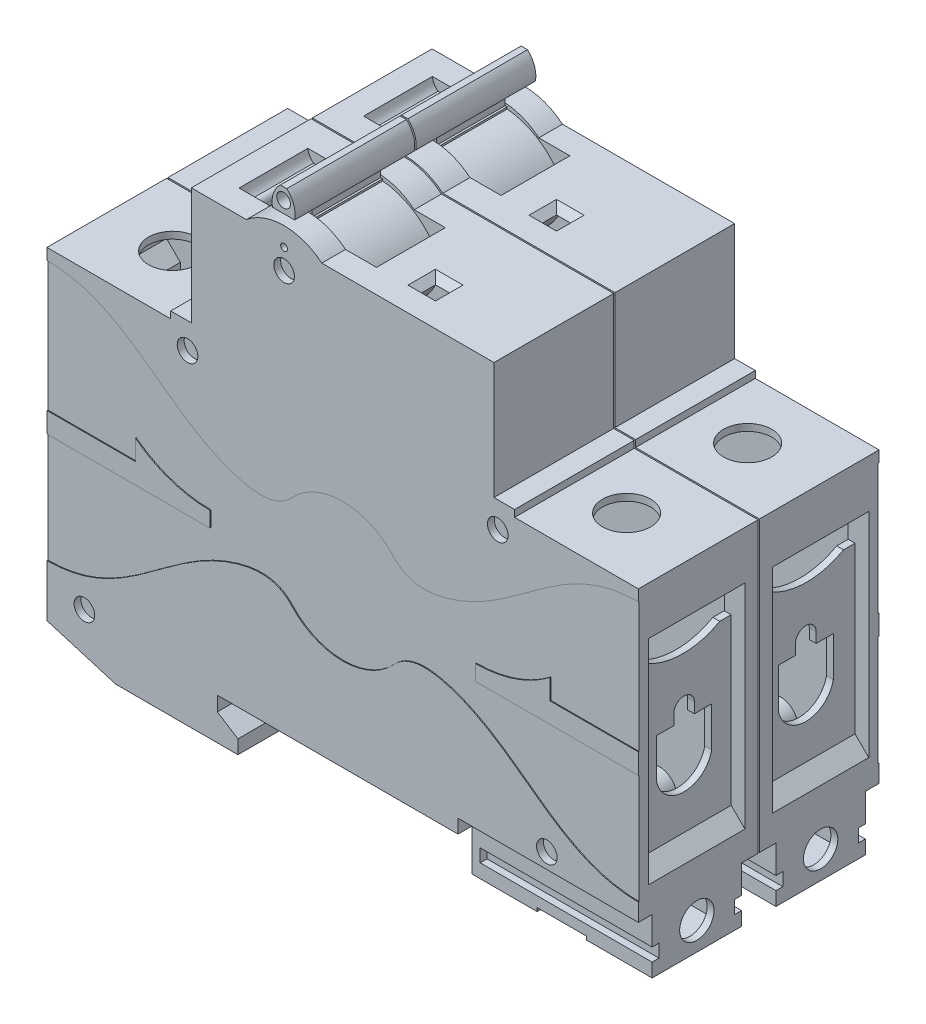
from build123d import *

# Parameters (mm, degrees)
BOSS_EXTRUDE1_DEPTH           = 17.5
SKETCH2_W                     = 26.226226643
SKETCH2_H                     = 2
SKETCH2_H_2                   = 5
CUT_EXTRUDE1_DEPTH            = 8
SKETCH3_W                     = 3
SKETCH3_H                     = 1.896489695
SKETCH3_W_2                   = 7
CUT_EXTRUDE2_DEPTH            = 25
SKETCH4_W                     = 7.201775376
SKETCH4_H                     = 1
CUT_EXTRUDE3_DEPTH            = 0.5
SKETCH6_W                     = 14
SKETCH6_H                     = 31
CUT_EXTRUDE5_DEPTH            = 2
CHAMFER1_SIZE                 = 2
SKETCH21_R                    = 2.5
SKETCH21_R_2                  = 1.5
BOSS_EXTRUDE3_DEPTH           = 35
SKETCH22_R                    = 1.5
CUT_EXTRUDE19_DEPTH           = 66.566759871
SKETCH14_W                    = 86
SKETCH14_H                    = 0.2
CUT_EXTRUDE11_DEPTH           = 83.33620103
CUT_EXTRUDE12_DEPTH           = 5
CUT_EXTRUDE12_DEPTH_BACK      = 3
SKETCH15_W                    = 20
SKETCH15_H                    = 10
CHAMFER1_OF_MIRROR1_SIZE      = 2
SHELL2_START                  = -16.5
SHELL2_OUTLINE_R              = 2.5
SHELL2_DEPTH                  = 15.4
SHELL2_START_2                = 1.1
SHELL2_2_OUTLINE_R            = 2.5
SHELL2_2_DEPTH                = 15.4
SHELL2_START_3                = -13.5
SHELL2_3_DEPTH                = 9
SHELL2_START_4                = 4.5
SHELL2_4_DEPTH                = 9
SHELL2_START_5                = -14.5
SHELL2_5_DEPTH                = 11
SHELL2_START_6                = 3.5
SHELL2_6_DEPTH                = 11
SHELL2_START_7                = -3.052474892
SHELL2_7_DEPTH                = 1.952474892
SHELL2_8_DEPTH                = 1.952474892
SHELL2_9_DEPTH                = 1.447525108
SHELL2_START_8                = 15.052474892
SHELL2_10_DEPTH               = 1.447525108
SKETCH13_W                    = 4
SKETCH13_H                    = 4
CUT_EXTRUDE10_DEPTH           = 2
CUT_EXTRUDE10_DRAFT           = -44
CUT_EXTRUDE10_PROFILE_2_DEPTH = 2
CUT_EXTRUDE10_PROFILE_2_DRAFT = -44
SKETCH9_R                     = 2.5
CUT_EXTRUDE8_DEPTH            = 10
SKETCH5_W                     = 1
SKETCH5_H                     = 8
CUT_EXTRUDE4_DEPTH            = 2
CUT_EXTRUDE7_DEPTH            = 10
CUT_EXTRUDE9_DEPTH            = 10
SKETCH16_R                    = 0.5
CUT_EXTRUDE17_DEPTH           = 66.566759871
SKETCH18_R                    = 3.5
CUT_EXTRUDE15_DEPTH           = 5
SKETCH23_R                    = 1.5
BOSS_EXTRUDE4_DEPTH           = 10
BOSS_EXTRUDE10_DEPTH          = 10
BOSS_EXTRUDE12_DEPTH          = 10
BOSS_EXTRUDE13_DEPTH          = 10
SKETCH31_R                    = 1.5
CUT_EXTRUDE20_DEPTH           = 67.356066779
BOSS_EXTRUDE14_DEPTH          = 10
SKETCH29_R                    = 1
BOSS_EXTRUDE15_DEPTH          = 35
SKETCH20_W                    = 86
SKETCH20_H                    = 0.2
CUT_EXTRUDE16_DEPTH           = 16
SKETCH32_R                    = 1.5
BOSS_EXTRUDE20_DEPTH          = 33
BOSS_EXTRUDE20_2_DEPTH        = 33
BOSS_EXTRUDE20_3_DEPTH        = 33
BOSS_EXTRUDE20_4_DEPTH        = 33
BOSS_EXTRUDE20_5_DEPTH        = 33
CUT_EXTRUDE21_DEPTH           = 0.125
CUT_EXTRUDE22_DEPTH           = 0.125


# Read off the part's stored shape, not the designer's step: Shell2
with BuildPart() as part:
    # Sketch1 → Boss-Extrude1 (new, symmetric)
    with BuildSketch(Plane.XY):
        with BuildLine():
            Line((-43, 15), (-25, 15))
            Line((-25, 15), (-25, 16))
            Line((-25, 16), (-22, 16))
            Line((-22, 16), (-22, 33))
            Line((-22, 33), (-14, 33))
            ThreePointArc((-14, 33), (-8.517768827, 34.98565789), (-3.035537653, 33))
            Line((-3.035537653, 33), (22, 33))
            Line((22, 33), (22, 16))
            Line((22, 16), (25, 16))
            Line((25, 16), (25, 15))
            Line((25, 15), (43, 15))
            Line((43, 15), (43, -35))
            Line((43, -35), (16.773773357, -35))
            Line((16.773773357, -35), (16.773773357, -29))
            Line((16.773773357, -29), (-18.226226643, -29))
            Line((-18.226226643, -29), (-18.226226643, -31.103510305))
            Line((-18.226226643, -31.103510305), (-15.226226643, -33))
            Line((-15.226226643, -33), (-15.226226643, -35))
            Line((-15.226226643, -35), (-33, -35))
            Line((-33, -35), (-43, -32))
            Line((-43, -32), (-43, 15))
        make_face()
    extrude(amount=BOSS_EXTRUDE1_DEPTH, both=True)

    # Sketch2 → Cut-Extrude1 (cut)
    with BuildSketch(Plane.XZ.offset(35)):
        with Locations((29.886886678, 16.5)):
            Rectangle(SKETCH2_W, SKETCH2_H)
        with Locations((29.886886678, 0)):
            Rectangle(SKETCH2_W, SKETCH2_H_2)
        with Locations((29.886886678, -16.5)):
            Rectangle(SKETCH2_W, SKETCH2_H)
    extrude(amount=-CUT_EXTRUDE1_DEPTH, mode=Mode.SUBTRACT)

    # Sketch3 → Cut-Extrude2 (cut)
    with BuildSketch(Plane(origin=(43, 0, 0), x_dir=(0, 0, -1), z_dir=(1, 0, 0))):
        with Locations((16, -32.051755153)):
            Rectangle(SKETCH3_W, SKETCH3_H)
        with Locations((0, -32.051755153)):
            Rectangle(SKETCH3_W_2, SKETCH3_H)
        with Locations((-16, -32.051755153)):
            Rectangle(SKETCH3_W, SKETCH3_H)
    extrude(amount=-CUT_EXTRUDE2_DEPTH, mode=Mode.SUBTRACT)

    # Sketch4 → Cut-Extrude3 (cut)
    with BuildSketch(Plane.XZ.offset(35)):
        with Locations((29.886886679, 15.5)):
            Rectangle(SKETCH4_W, SKETCH4_H)
        with Locations((29.886886679, 2.5)):
            Rectangle(SKETCH4_W, SKETCH4_H)
        with Locations((29.886886679, -2.5)):
            Rectangle(SKETCH4_W, SKETCH4_H)
        with Locations((29.886886679, -15.5)):
            Rectangle(SKETCH4_W, SKETCH4_H)
    extrude(amount=-CUT_EXTRUDE3_DEPTH, mode=Mode.SUBTRACT)

    # Sketch6 → Cut-Extrude5 (cut)
    with BuildSketch(Plane.ZY.offset(43)):
        with Locations((-9, -7.5)):
            Rectangle(SKETCH6_W, SKETCH6_H)
        with Locations((9, -7.5)):
            Rectangle(SKETCH6_W, SKETCH6_H)
    cut_extrude5 = extrude(amount=-CUT_EXTRUDE5_DEPTH, mode=Mode.SUBTRACT)

    # Chamfer1
    chamfer1_edges = [part.edges().sort_by_distance(p)[0] for p in [
        (-41, -23, 9),
        (-41, -23, -9),
        (-41, 8, 9),
        (-41, 8, -9),
    ]]
    chamfer(chamfer1_edges, length=CHAMFER1_SIZE - 0.0001)  # a hair under: the kernel refuses the full size

    # Sketch21 → Boss-Extrude3 (add)
    # profile 1 of 4: a face of its own
    with BuildSketch(Plane.XY.offset(17.5)):
        with Locations((-22.553517734, 12.23222424)):
            Circle(SKETCH21_R)
        with Locations((-22.553517734, 12.23222424)):
            Circle(SKETCH21_R_2, mode=Mode.SUBTRACT)
    # profile 2 of 4: a face of its own
    with BuildSketch(Plane.XY.offset(17.5)):
        with Locations((-37.547263916, -27.874280993)):
            Circle(SKETCH21_R)
        with Locations((-37.547263916, -27.874280993)):
            Circle(SKETCH21_R_2, mode=Mode.SUBTRACT)
    # profile 3 of 4: a face of its own
    with BuildSketch(Plane.XY.offset(17.5)):
        with BuildLine():
            ThreePointArc((30.819031875, -27), (31.82295748, -26.078429992), (32.19438906, -24.767248662))
            ThreePointArc((32.19438906, -24.767248662), (28.38320773, -22.638680242), (28.569746246, -27))
            Line((28.569746246, -27), (30.819031875, -27))
        make_face()
        with Locations((29.69438906, -24.767248662)):
            Circle(SKETCH21_R_2, mode=Mode.SUBTRACT)
    # profile 4 of 4: a face of its own
    with BuildSketch(Plane.XY.offset(17.5)):
        with Locations((22.553517734, 12.23222424)):
            Circle(SKETCH21_R)
    extrude(amount=-BOSS_EXTRUDE3_DEPTH)

    # Sketch22 → Cut-Extrude19 (cut, through all)
    with BuildSketch(Plane.XY.offset(17.5)):
        with Locations((22.553517734, 12.23222424)):
            Circle(SKETCH22_R)
        with Locations((-22.553517734, 12.23222424)):
            Circle(SKETCH22_R)
        with Locations((-37.547263916, -27.874280993)):
            Circle(SKETCH22_R)
        with Locations((29.69438906, -24.767248662)):
            Circle(SKETCH22_R)
    extrude(amount=-CUT_EXTRUDE19_DEPTH, mode=Mode.SUBTRACT)

    # Sketch14 → Cut-Extrude11 (cut, through all)
    with BuildSketch(Plane(origin=(0, 33, 0), x_dir=(1, 0, 0), z_dir=(0, 1, 0))):
        Rectangle(SKETCH14_W, SKETCH14_H)
    extrude(amount=-CUT_EXTRUDE11_DEPTH, mode=Mode.SUBTRACT)

    # Sketch15 → Cut-Extrude12 (cut, two sides: drawn at the far end of the back side and taken through both)
    with BuildSketch(Plane(origin=(0, 33, 0), x_dir=(1, 0, 0), z_dir=(0, 1, 0)).offset(-CUT_EXTRUDE12_DEPTH_BACK)):
        with Locations((-8.517768827, 9.052474892)):
            Rectangle(SKETCH15_W, SKETCH15_H)
        with Locations((-8.517768827, -9.052474892)):
            Rectangle(SKETCH15_W, SKETCH15_H)
    extrude(amount=CUT_EXTRUDE12_DEPTH + CUT_EXTRUDE12_DEPTH_BACK, mode=Mode.SUBTRACT)

    # Mirror1: Cut-Extrude5 across plane
    add(cut_extrude5.mirror(Plane(origin=(0, 0, 0), x_dir=(0, 0, 1), z_dir=(1, 0, 0))), mode=Mode.SUBTRACT)

    # Chamfer1 of Mirror1
    chamfer1_of_mirror1_edges = [part.edges().sort_by_distance(p)[0] for p in [
        (41, -23, 9),
        (41, -23, -9),
        (41, 8, 9),
        (41, 8, -9),
    ]]
    chamfer(chamfer1_of_mirror1_edges, length=CHAMFER1_OF_MIRROR1_SIZE - 0.0001)  # a hair under: the kernel refuses the full size

    # Shell2 outline → Shell2 (cut)
    with BuildSketch(Plane.XY.offset(SHELL2_START)):
        with BuildLine():
            Line((2.482231173, 30), (-19.517768827, 30))
            Line((-19.517768827, 30), (-19.517768827, 32))
            Line((-19.517768827, 32), (-21, 32))
            Line((-21, 32), (-21, 15))
            Line((-21, 15), (-24, 15))
            Line((-24, 15), (-24, 14.271265449))
            ThreePointArc((-24, 14.271265449), (-20.940684333, 10.322049268), (-24.32127588, 14))
            Line((-24.32127588, 14), (-42, 14))
            Line((-42, 14), (-42, 8.414213562))
            Line((-42, 8.414213562), (-40, 6.414213562))
            Line((-40, 6.414213562), (-40, -21.414213562))
            Line((-40, -21.414213562), (-42, -23.414213562))
            Line((-42, -23.414213562), (-42, -31.255969349))
            Line((-42, -31.255969349), (-32.853231164, -34))
            Line((-32.853231164, -34), (-16.226226643, -34))
            Line((-16.226226643, -34), (-16.226226643, -33.55089651))
            Line((-16.226226643, -33.55089651), (-19.226226643, -31.654406815))
            Line((-19.226226643, -31.654406815), (-19.226226643, -28))
            Line((-19.226226643, -28), (15.773773357, -28))
            Line((15.773773357, -28), (15.773773357, -26))
            Line((15.773773357, -26), (27.519458225, -26))
            ThreePointArc((27.519458225, -26), (29.69438906, -22.267248662), (31.869319895, -26))
            Line((31.869319895, -26), (42, -26))
            Line((42, -26), (42, -23.414213562))
            Line((42, -23.414213562), (40, -21.414213562))
            Line((40, -21.414213562), (40, 6.414213562))
            Line((40, 6.414213562), (42, 8.414213562))
            Line((42, 8.414213562), (42, 14))
            Line((42, 14), (24.32127588, 14))
            ThreePointArc((24.32127588, 14), (20.940684333, 10.322049268), (24, 14.271265449))
            Line((24, 14.271265449), (24, 15))
            Line((24, 15), (21, 15))
            Line((21, 15), (21, 32))
            Line((21, 32), (2.482231173, 32))
            Line((2.482231173, 32), (2.482231173, 30))
        make_face()
        with Locations((-37.547263916, -27.874280993)):
            Circle(SHELL2_OUTLINE_R, mode=Mode.SUBTRACT)
    extrude(amount=SHELL2_DEPTH, mode=Mode.SUBTRACT)

    # Shell2 2 outline → Shell2 2 (cut)
    with BuildSketch(Plane.XY.offset(SHELL2_START_2)):
        with BuildLine():
            Line((2.482231173, 30), (-19.517768827, 30))
            Line((-19.517768827, 30), (-19.517768827, 32))
            Line((-19.517768827, 32), (-21, 32))
            Line((-21, 32), (-21, 15))
            Line((-21, 15), (-24, 15))
            Line((-24, 15), (-24, 14.271265449))
            ThreePointArc((-24, 14.271265449), (-20.940684333, 10.322049268), (-24.32127588, 14))
            Line((-24.32127588, 14), (-42, 14))
            Line((-42, 14), (-42, 8.414213562))
            Line((-42, 8.414213562), (-40, 6.414213562))
            Line((-40, 6.414213562), (-40, -21.414213562))
            Line((-40, -21.414213562), (-42, -23.414213562))
            Line((-42, -23.414213562), (-42, -31.255969349))
            Line((-42, -31.255969349), (-32.853231164, -34))
            Line((-32.853231164, -34), (-16.226226643, -34))
            Line((-16.226226643, -34), (-16.226226643, -33.55089651))
            Line((-16.226226643, -33.55089651), (-19.226226643, -31.654406815))
            Line((-19.226226643, -31.654406815), (-19.226226643, -28))
            Line((-19.226226643, -28), (15.773773357, -28))
            Line((15.773773357, -28), (15.773773357, -26))
            Line((15.773773357, -26), (27.519458225, -26))
            ThreePointArc((27.519458225, -26), (29.69438906, -22.267248662), (31.869319895, -26))
            Line((31.869319895, -26), (42, -26))
            Line((42, -26), (42, -23.414213562))
            Line((42, -23.414213562), (40, -21.414213562))
            Line((40, -21.414213562), (40, 6.414213562))
            Line((40, 6.414213562), (42, 8.414213562))
            Line((42, 8.414213562), (42, 14))
            Line((42, 14), (24.32127588, 14))
            ThreePointArc((24.32127588, 14), (20.940684333, 10.322049268), (24, 14.271265449))
            Line((24, 14.271265449), (24, 15))
            Line((24, 15), (21, 15))
            Line((21, 15), (21, 32))
            Line((21, 32), (2.482231173, 32))
            Line((2.482231173, 32), (2.482231173, 30))
        make_face()
        with Locations((-37.547263916, -27.874280993)):
            Circle(SHELL2_2_OUTLINE_R, mode=Mode.SUBTRACT)
    extrude(amount=SHELL2_2_DEPTH, mode=Mode.SUBTRACT)

    # Shell2 3 outline → Shell2 3 (cut)
    with BuildSketch(Plane.XY.offset(SHELL2_START_3)):
        with BuildLine():
            Line((42, -26), (31.869319895, -26))
            ThreePointArc((31.869319895, -26), (29.69438906, -27.267248662), (27.519458225, -26))
            Line((27.519458225, -26), (15.773773357, -26))
            Line((15.773773357, -26), (15.773773357, -28))
            Line((15.773773357, -28), (17.773773357, -28))
            Line((17.773773357, -28), (17.773773357, -34))
            Line((17.773773357, -34), (42, -34))
            Line((42, -34), (42, -26))
        make_face()
    extrude(amount=SHELL2_3_DEPTH, mode=Mode.SUBTRACT)

    # Shell2 4 outline → Shell2 4 (cut)
    with BuildSketch(Plane.XY.offset(SHELL2_START_4)):
        with BuildLine():
            Line((42, -26), (31.869319895, -26))
            ThreePointArc((31.869319895, -26), (29.69438906, -27.267248662), (27.519458225, -26))
            Line((27.519458225, -26), (15.773773357, -26))
            Line((15.773773357, -26), (15.773773357, -28))
            Line((15.773773357, -28), (17.773773357, -28))
            Line((17.773773357, -28), (17.773773357, -34))
            Line((17.773773357, -34), (42, -34))
            Line((42, -34), (42, -26))
        make_face()
    extrude(amount=SHELL2_4_DEPTH, mode=Mode.SUBTRACT)

    # Shell2 5 outline → Shell2 5 (cut)
    with BuildSketch(Plane.XY.offset(SHELL2_START_5)):
        with BuildLine():
            Line((42, -30.103510305), (42, -26))
            Line((42, -26), (31.869319895, -26))
            ThreePointArc((31.869319895, -26), (29.69438906, -27.267248662), (27.519458225, -26))
            Line((27.519458225, -26), (15.773773357, -26))
            Line((15.773773357, -26), (15.773773357, -28))
            Line((15.773773357, -28), (17.773773357, -28))
            Line((17.773773357, -28), (17.773773357, -30.103510305))
            Line((17.773773357, -30.103510305), (42, -30.103510305))
        make_face()
    extrude(amount=SHELL2_5_DEPTH, mode=Mode.SUBTRACT)

    # Shell2 6 outline → Shell2 6 (cut)
    with BuildSketch(Plane.XY.offset(SHELL2_START_6)):
        with BuildLine():
            Line((42, -30.103510305), (42, -26))
            Line((42, -26), (31.869319895, -26))
            ThreePointArc((31.869319895, -26), (29.69438906, -27.267248662), (27.519458225, -26))
            Line((27.519458225, -26), (15.773773357, -26))
            Line((15.773773357, -26), (15.773773357, -28))
            Line((15.773773357, -28), (17.773773357, -28))
            Line((17.773773357, -28), (17.773773357, -30.103510305))
            Line((17.773773357, -30.103510305), (42, -30.103510305))
        make_face()
    extrude(amount=SHELL2_6_DEPTH, mode=Mode.SUBTRACT)

    # Shell2 7 outline → Shell2 7 (cut)
    with BuildSketch(Plane.XY.offset(SHELL2_START_7)):
        with BuildLine():
            Line((-19.517768827, 32), (-19.517768827, 30))
            Line((-19.517768827, 30), (2.482231173, 30))
            Line((2.482231173, 30), (2.482231173, 32))
            Line((2.482231173, 32), (-3.410563832, 32))
            ThreePointArc((-3.410563832, 32), (-8.517768826, 33.98565789), (-13.624973821, 32))
            Line((-13.624973821, 32), (-19.517768827, 32))
        make_face()
    extrude(amount=SHELL2_7_DEPTH, mode=Mode.SUBTRACT)

    # Shell2 8 outline → Shell2 8 (cut)
    with BuildSketch(Plane.XY.offset(SHELL2_START_2)):
        with BuildLine():
            Line((-19.517768827, 32), (-19.517768827, 30))
            Line((-19.517768827, 30), (2.482231173, 30))
            Line((2.482231173, 30), (2.482231173, 32))
            Line((2.482231173, 32), (-3.410563832, 32))
            ThreePointArc((-3.410563832, 32), (-8.517768826, 33.98565789), (-13.624973821, 32))
            Line((-13.624973821, 32), (-19.517768827, 32))
        make_face()
    extrude(amount=SHELL2_8_DEPTH, mode=Mode.SUBTRACT)

    # Shell2 9 outline → Shell2 9 (cut)
    with BuildSketch(Plane.XY.offset(SHELL2_START)):
        with BuildLine():
            Line((-19.517768827, 32), (-19.517768827, 30))
            Line((-19.517768827, 30), (2.482231173, 30))
            Line((2.482231173, 30), (2.482231173, 32))
            Line((2.482231173, 32), (-3.410563832, 32))
            ThreePointArc((-3.410563832, 32), (-8.517768826, 33.98565789), (-13.624973821, 32))
            Line((-13.624973821, 32), (-19.517768827, 32))
        make_face()
    extrude(amount=SHELL2_9_DEPTH, mode=Mode.SUBTRACT)

    # Shell2 10 outline → Shell2 10 (cut)
    with BuildSketch(Plane.XY.offset(SHELL2_START_8)):
        with BuildLine():
            Line((-19.517768827, 32), (-19.517768827, 30))
            Line((-19.517768827, 30), (2.482231173, 30))
            Line((2.482231173, 30), (2.482231173, 32))
            Line((2.482231173, 32), (-3.410563832, 32))
            ThreePointArc((-3.410563832, 32), (-8.517768826, 33.98565789), (-13.624973821, 32))
            Line((-13.624973821, 32), (-19.517768827, 32))
        make_face()
    extrude(amount=SHELL2_10_DEPTH, mode=Mode.SUBTRACT)


with BuildPart() as cut_extrude10_tool:
    # Sketch13 → Cut-Extrude10 (with draft: the straight prism first)
    with BuildSketch(Plane(origin=(0, 33, 0), x_dir=(1, 0, 0), z_dir=(0, 1, 0))):
        with Locations((8, 5.6)):
            Rectangle(SKETCH13_W, SKETCH13_H)
    extrude(amount=-CUT_EXTRUDE10_DEPTH)
    # Cut-Extrude10: the draft: its side faces are tilted about the plane it starts from
    cut_extrude10_sides = [cut_extrude10_tool.faces().sort_by_distance(p)[0] for p in [
        (10, 32, -5.6),
        (8, 32, -7.6),
        (6, 32, -5.6),
        (8, 32, -3.6),
    ]]
    draft(cut_extrude10_sides, Plane(origin=(0, 33, 0), x_dir=(1, 0, 0), z_dir=(0, 1, 0)), CUT_EXTRUDE10_DRAFT)


with BuildPart() as part_1:
    add(part.part)

    # Cut-Extrude10: cut by cut_extrude10_tool
    add(cut_extrude10_tool.part, mode=Mode.SUBTRACT)


with BuildPart() as cut_extrude10_profile_2_tool:
    # Sketch13 → Cut-Extrude10 profile 2 (with draft: the straight prism first)
    with BuildSketch(Plane(origin=(0, 33, 0), x_dir=(1, 0, 0), z_dir=(0, 1, 0))):
        with Locations((8, -12)):
            Rectangle(SKETCH13_W, SKETCH13_H)
    extrude(amount=-CUT_EXTRUDE10_PROFILE_2_DEPTH)
    # Cut-Extrude10 profile 2: the draft: its side faces are tilted about the plane it starts from
    cut_extrude10_profile_2_sides = [cut_extrude10_profile_2_tool.faces().sort_by_distance(p)[0] for p in [
        (8, 32, 10),
        (6, 32, 12),
        (8, 32, 14),
        (10, 32, 12),
    ]]
    draft(cut_extrude10_profile_2_sides, Plane(origin=(0, 33, 0), x_dir=(1, 0, 0), z_dir=(0, 1, 0)), CUT_EXTRUDE10_PROFILE_2_DRAFT)


with BuildPart() as part_2:
    add(part_1.part)

    # Cut-Extrude10 profile 2: cut by cut_extrude10_profile_2_tool
    add(cut_extrude10_profile_2_tool.part, mode=Mode.SUBTRACT)

    # Sketch9 → Cut-Extrude8 (cut)
    with BuildSketch(Plane(origin=(43, 0, 0), x_dir=(0, 0, -1), z_dir=(1, 0, 0))):
        with Locations((-9, -31)):
            Circle(SKETCH9_R)
        with Locations((9, -31)):
            Circle(SKETCH9_R)
    extrude(amount=-CUT_EXTRUDE8_DEPTH, mode=Mode.SUBTRACT)

    # Sketch5 → Cut-Extrude4 (cut)
    with BuildSketch(Plane(origin=(-12.357798165, -41.19266055, 0), x_dir=(0.9578262852211513, -0.2873478855663458, 0), z_dir=(-0.2873478855663458, -0.9578262852211514, 0))):
        with Locations((-26.996748548, 8.75)):
            Rectangle(SKETCH5_W, SKETCH5_H)
        with Locations((-29.996748548, 8.75)):
            Rectangle(SKETCH5_W, SKETCH5_H)
        with Locations((-23.996748548, 8.75)):
            Rectangle(SKETCH5_W, SKETCH5_H)
        with Locations((-23.996748548, -8.75)):
            Rectangle(SKETCH5_W, SKETCH5_H)
        with Locations((-26.996748548, -8.75)):
            Rectangle(SKETCH5_W, SKETCH5_H)
        with Locations((-29.996748548, -8.75)):
            Rectangle(SKETCH5_W, SKETCH5_H)
    extrude(amount=-CUT_EXTRUDE4_DEPTH, mode=Mode.SUBTRACT)

    # Sketch8 → Cut-Extrude7 (cut)
    with BuildSketch(Plane.ZY.offset(41)):
        with BuildLine():
            Line((-6.033598852, -0.5), (-5, -0.5))
            Line((-5, -0.5), (-5, 1))
            Line((-5, 1), (-13, 1))
            Line((-13, 1), (-13, -0.5))
            Line((-13, -0.5), (-12.218858052, -0.5))
            Line((-12.218858052, -0.5), (-12.218858052, -1.5))
            Line((-12.218858052, -1.5), (-13, -1.5))
            Line((-13, -1.5), (-13, -5.290597963))
            ThreePointArc((-13, -5.290597963), (-9, -9), (-5, -5.290597963))
            Line((-5, -5.290597963), (-5, -1.5))
            Line((-5, -1.5), (-6.033598852, -1.5))
            Line((-6.033598852, -1.5), (-6.033598852, -0.5))
        make_face()
        with BuildLine():
            Line((6.033598852, -1.5), (5, -1.5))
            Line((5, -1.5), (5, -5.290597963))
            ThreePointArc((5, -5.290597963), (9, -9), (13, -5.290597963))
            Line((13, -5.290597963), (13, -1.5))
            Line((13, -1.5), (12.218858052, -1.5))
            Line((12.218858052, -1.5), (12.218858052, -0.5))
            Line((12.218858052, -0.5), (13, -0.5))
            Line((13, -0.5), (13, 1))
            Line((13, 1), (5, 1))
            Line((5, 1), (5, -0.5))
            Line((5, -0.5), (6.033598852, -0.5))
            Line((6.033598852, -0.5), (6.033598852, -1.5))
        make_face()
    extrude(amount=-CUT_EXTRUDE7_DEPTH, mode=Mode.SUBTRACT)

    # Sketch10 → Cut-Extrude9 (cut)
    with BuildSketch(Plane(origin=(41, 0, 0), x_dir=(0, 0, -1), z_dir=(1, 0, 0))):
        with BuildLine():
            Line((-16, 6), (-2, 6))
            Line((-2, 6), (-2, 3))
            Line((-2, 3), (-3.666459519, 3))
            ThreePointArc((-3.666459519, 3), (-9, 1.601606409), (-14.333540481, 3))
            Line((-14.333540481, 3), (-16, 3))
            Line((-16, 3), (-16, 6))
        make_face()
        with BuildLine():
            Line((-7.349825054, -6.798737612), (-4.849825054, -6.798737612))
            Line((-4.849825054, -6.798737612), (-4.849825054, -12.606891478))
            ThreePointArc((-4.849825054, -12.606891478), (-8.849825054, -15.87956016), (-12.849825054, -12.606891478))
            Line((-12.849825054, -12.606891478), (-12.849825054, -6.798737612))
            Line((-12.849825054, -6.798737612), (-10.349825054, -6.798737612))
            Line((-10.349825054, -6.798737612), (-10.349825054, -5.298737612))
            ThreePointArc((-10.349825054, -5.298737612), (-8.849825054, -3.798737612), (-7.349825054, -5.298737612))
            Line((-7.349825054, -5.298737612), (-7.349825054, -6.798737612))
        make_face()
        with BuildLine():
            Line((7.349825054, -5.298737612), (7.349825054, -6.798737612))
            Line((7.349825054, -6.798737612), (4.849825054, -6.798737612))
            Line((4.849825054, -6.798737612), (4.849825054, -12.606891478))
            ThreePointArc((4.849825054, -12.606891478), (8.849825054, -15.87956016), (12.849825054, -12.606891478))
            Line((12.849825054, -12.606891478), (12.849825054, -6.798737612))
            Line((12.849825054, -6.798737612), (10.349825054, -6.798737612))
            Line((10.349825054, -6.798737612), (10.349825054, -5.298737612))
            ThreePointArc((10.349825054, -5.298737612), (8.849825054, -3.798737612), (7.349825054, -5.298737612))
        make_face()
        with BuildLine():
            Line((3.666459519, 3), (2, 3))
            Line((2, 3), (2, 6))
            Line((2, 6), (16, 6))
            Line((16, 6), (16, 3))
            Line((16, 3), (14.333540481, 3))
            ThreePointArc((14.333540481, 3), (9, 1.601606409), (3.666459519, 3))
        make_face()
    extrude(amount=-CUT_EXTRUDE9_DEPTH, mode=Mode.SUBTRACT)

    # Sketch16 → Cut-Extrude17 (cut, through all)
    with BuildSketch(Plane.XY.offset(17.5)):
        with Locations((-8.511211784, 32.261177341)):
            Circle(SKETCH16_R)
    extrude(amount=-CUT_EXTRUDE17_DEPTH, mode=Mode.SUBTRACT)

    # Sketch18 → Cut-Extrude15 (cut)
    with BuildSketch(Plane(origin=(0, 15, 0), x_dir=(1, 0, 0), z_dir=(0, 1, 0))):
        with Locations(Location((-33.424522679, 8.8, 0), (0, 0, 180))):
            Circle(SKETCH18_R)
        with Locations(Location((32.588909612, 8.8, 0), (0, 0, 180))):
            Circle(SKETCH18_R)
        with Locations(Location((-33.424522679, -8.8, 0), (0, 0, 180))):
            Circle(SKETCH18_R)
        with Locations(Location((32.588909612, -8.8, 0), (0, 0, 180))):
            Circle(SKETCH18_R)
    extrude(amount=-CUT_EXTRUDE15_DEPTH, mode=Mode.SUBTRACT)

    # Sketch23 → Boss-Extrude4 (add)
    with BuildSketch(Plane.XY.offset(4.052474892)):
        with BuildLine():
            Line((-9.177479498, 34.5998186), (-9.477479498, 34.5998186))
            Line((-9.477479498, 34.5998186), (-9.477479498, 34.319507846))
            ThreePointArc((-9.477479498, 34.319507846), (-14.680166842, 32.237191328), (-17.945756759, 27.683081077))
            ThreePointArc((-17.945756759, 27.683081077), (-8.511852071, 19.749464396), (0.922052617, 27.683081077))
            ThreePointArc((0.922052617, 27.683081077), (-2.375703991, 32.26229399), (-7.627479498, 34.327056346))
            Line((-7.627479498, 34.327056346), (-7.627479498, 34.5998186))
            Line((-7.627479498, 34.5998186), (-7.927479498, 34.5998186))
            Line((-7.927479498, 34.5998186), (-7.927479498, 36.457202284))
            Line((-7.927479498, 36.457202284), (-9.177479498, 36.457202284))
            Line((-9.177479498, 36.457202284), (-9.177479498, 34.5998186))
        make_face()
        with Locations(Location((-8.511852071, 29.3252252, 0), (0, 0, 153.265948048))):
            Circle(SKETCH23_R, mode=Mode.SUBTRACT)
    extrude(amount=BOSS_EXTRUDE4_DEPTH)

    # Sketch24 → Boss-Extrude10 (add)
    with BuildSketch(Plane.XY.offset(4.052474892)):
        with BuildLine():
            ThreePointArc((0.662365374, 31.544147774), (0.089744271, 31.339641741), (-0.170552391, 30.790129874))
            Line((-0.170552391, 30.790129874), (-0.170552391, 30))
            Line((-0.170552391, 30), (1.482231173, 30))
            Line((1.482231173, 30), (1.482231173, 33))
            ThreePointArc((1.482231173, 33), (1.22743949, 32.184705832), (0.662365374, 31.544147774))
        make_face()
    extrude(amount=BOSS_EXTRUDE10_DEPTH)

    # Sketch26 → Boss-Extrude12 (add)
    with BuildSketch(Plane.XY.offset(4.052474892)):
        with BuildLine():
            Line((-16.851871176, 30.790129874), (-16.851871176, 30))
            Line((-16.851871176, 30), (-18.753994578, 30))
            Line((-18.753994578, 30), (-18.753994578, 33))
            Line((-18.753994578, 33), (-18.504654741, 33))
            ThreePointArc((-18.504654741, 33), (-18.249863057, 32.184705832), (-17.684788942, 31.544147774))
            ThreePointArc((-17.684788942, 31.544147774), (-17.112167839, 31.339641741), (-16.851871176, 30.790129874))
        make_face()
    extrude(amount=BOSS_EXTRUDE12_DEPTH)

    # Sketch27 → Boss-Extrude13 (add)
    with BuildSketch(Plane.XY.offset(-14.052474892)):
        with BuildLine():
            Line((-7.927479498, 36.457202284), (-9.177479498, 36.457202284))
            Line((-9.177479498, 36.457202284), (-9.177479498, 34.5998186))
            Line((-9.177479498, 34.5998186), (-9.477479498, 34.5998186))
            Line((-9.477479498, 34.5998186), (-9.477479498, 34.319507846))
            ThreePointArc((-9.477479498, 34.319507846), (-14.680166842, 32.237191328), (-17.945756759, 27.683081077))
            ThreePointArc((-17.945756759, 27.683081077), (-8.511852071, 19.749464396), (0.922052617, 27.683081077))
            ThreePointArc((0.922052617, 27.683081077), (-2.375703991, 32.26229399), (-7.627479498, 34.327056346))
            Line((-7.627479498, 34.327056346), (-7.627479498, 34.5998186))
            Line((-7.627479498, 34.5998186), (-7.927479498, 34.5998186))
            Line((-7.927479498, 34.5998186), (-7.927479498, 36.457202284))
        make_face()
    extrude(amount=BOSS_EXTRUDE13_DEPTH)

    # Sketch31 → Cut-Extrude20 (cut, through all)
    with BuildSketch(Plane.XY.offset(17.5)):
        with Locations(Location((-8.511852071, 29.3252252, 0), (0, 0, 153.265948048))):
            Circle(SKETCH31_R)
    extrude(amount=-CUT_EXTRUDE20_DEPTH, mode=Mode.SUBTRACT)

    # Sketch28 → Boss-Extrude14 (add)
    with BuildSketch(Plane.XY.offset(-14.052474892)):
        with BuildLine():
            Line((-0.170552391, 30.790129874), (-0.170552391, 30))
            Line((-0.170552391, 30), (1.731571011, 30))
            Line((1.731571011, 30), (1.731571011, 33))
            Line((1.731571011, 33), (1.482231173, 33))
            ThreePointArc((1.482231173, 33), (1.22743949, 32.184705832), (0.662365374, 31.544147774))
            ThreePointArc((0.662365374, 31.544147774), (0.089744271, 31.339641741), (-0.170552391, 30.790129874))
        make_face()
        with BuildLine():
            Line((-16.851871176, 30), (-16.851871176, 30.790129874))
            ThreePointArc((-16.851871176, 30.790129874), (-17.112167839, 31.339641741), (-17.684788942, 31.544147774))
            ThreePointArc((-17.684788942, 31.544147774), (-18.249863057, 32.184705832), (-18.504654741, 33))
            Line((-18.504654741, 33), (-18.753994578, 33))
            Line((-18.753994578, 33), (-18.753994578, 30))
            Line((-18.753994578, 30), (-16.851871176, 30))
        make_face()
    extrude(amount=BOSS_EXTRUDE14_DEPTH)

    # Sketch29 → Boss-Extrude15 (add)
    with BuildSketch(Plane.XY.offset(17.5)):
        with BuildLine():
            Line((-9.052644634, 39.83340628), (-8.12235407, 39.83340628))
            ThreePointArc((-8.12235407, 39.83340628), (-7.107995588, 38.294889169), (-6.97064586, 36.457202284))
            Line((-6.97064586, 36.457202284), (-10.204352845, 36.457202284))
            ThreePointArc((-10.204352845, 36.457202284), (-10.067003117, 38.294889169), (-9.052644634, 39.83340628))
        make_face()
        with Locations((-8.587499352, 38.145304282)):
            Circle(SKETCH29_R, mode=Mode.SUBTRACT)
    extrude(amount=-BOSS_EXTRUDE15_DEPTH)

    # Sketch20 → Cut-Extrude16 (cut)
    with BuildSketch(Plane(origin=(0, 33, 0), x_dir=(1, 0, 0), z_dir=(0, 1, 0))):
        Rectangle(SKETCH20_W, SKETCH20_H)
    extrude(amount=CUT_EXTRUDE16_DEPTH, mode=Mode.SUBTRACT)


with BuildPart() as cut_extrude16_piece_1:
    # of the separate pieces the step leaves, piece 1, a body of its own (cut_extrude16_pieces)
    add(part_2.part.solids().sort_by_distance((-6.97064586, 36.457202284, 17.5))[0])

    # Sketch33 → Cut-Extrude21 (cut)
    with BuildSketch(Plane.XY.offset(17.5)):
        with BuildLine():
            Line((-43, -5.534161957), (-30.135989632, -5.534161957))
            Line((-30.135989632, -5.534161957), (-30.135989632, -2.594863125))
            ThreePointArc((-30.135989632, -2.594863125), (-25.013500029, -5.314547199), (-19.290383547, -6.253971991))
            Line((-19.290383547, -6.253971991), (-19.290383547, -8.5))
            Line((-19.290383547, -8.5), (-43, -8.5))
            Line((-43, -8.5), (-43, -24.434053015))
            add(Edge.make_bspline(
                [(-43, -24.434053015), (-31.290440265, -24.434338933), (-24.4038185, -11.450538247), (-9.627845656, -9.910460471), (-7.397762351, -12.335945734)],
                knots=[0, 0, 0, 0, 0.789194174, 1, 1, 1, 1], degree=3))
            ThreePointArc((-7.397762351, -12.335945734), (0, -15.583597281), (7.397762351, -12.335945734))
            add(Edge.make_bspline(
                [(43, -24.434053015), (31.290440265, -24.434338933), (24.4038185, -11.450538247), (9.627845656, -9.910460471), (7.397762351, -12.335945734)],
                knots=[0, 0, 0, 0, 0.789194174, 1, 1, 1, 1], degree=3))
            Line((43, -24.434053015), (43, -8.5))
            Line((43, -8.5), (19.290383547, -8.5))
            Line((19.290383547, -8.5), (19.290383547, -6.253971991))
            ThreePointArc((19.290383547, -6.253971991), (25.013500029, -5.314547199), (30.135989632, -2.594863125))
            Line((30.135989632, -2.594863125), (30.135989632, -5.534161957))
            Line((30.135989632, -5.534161957), (43, -5.534161957))
            Line((43, -5.534161957), (43, 13.365729102))
            add(Edge.make_bspline(
                [(43, 13.365729102), (31.290440265, 13.36601502), (24.4038185, 0.382214334), (9.627845656, -1.157863442), (7.397762351, 1.267621821)],
                knots=[0, 0, 0, 0, 0.789194174, 1, 1, 1, 1], degree=3))
            ThreePointArc((7.397762351, 1.267621821), (0, 4.515273368), (-7.397762351, 1.267621821))
            add(Edge.make_bspline(
                [(-43, 13.365729102), (-31.290440265, 13.36601502), (-24.4038185, 0.382214334), (-9.627845656, -1.157863442), (-7.397762351, 1.267621821)],
                knots=[0, 0, 0, 0, 0.789194174, 1, 1, 1, 1], degree=3))
            Line((-43, 13.365729102), (-43, -5.534161957))
        make_face()
    extrude(amount=-CUT_EXTRUDE21_DEPTH, mode=Mode.SUBTRACT)


with BuildPart() as cut_extrude16_piece_2:
    # of the separate pieces the step leaves, piece 2, a body of its own (cut_extrude16_pieces)
    add(part_2.part.solids().sort_by_distance((-10.204352845, 36.457202284, -0.1))[0])

    # Sketch34 → Cut-Extrude22 (cut)
    with BuildSketch(Plane(origin=(0, 0, -17.5), x_dir=(-1, 0, 0), z_dir=(0, 0, -1))):
        with BuildLine():
            Line((30.135989632, -2.594863125), (30.135989632, -5.534161957))
            Line((30.135989632, -5.534161957), (43, -5.534161957))
            Line((43, -5.534161957), (43, 13.365729102))
            add(Edge.make_bspline(
                [(43, 13.365729102), (31.290440265, 13.36601502), (24.4038185, 0.382214334), (9.627845656, -1.157863442), (7.397762351, 1.267621821)],
                knots=[0, 0, 0, 0, 0.789194174, 1, 1, 1, 1], degree=3))
            ThreePointArc((7.397762351, 1.267621821), (0, 4.515273368), (-7.397762351, 1.267621821))
            add(Edge.make_bspline(
                [(-7.397762351, 1.267621821), (-9.627845656, -1.157863442), (-24.4038185, 0.382214334), (-31.290440265, 13.36601502), (-43, 13.365729102)],
                knots=[0, 0, 0, 0, 0.210805826, 1, 1, 1, 1], degree=3))
            Line((-43, 13.365729102), (-43, -5.534161957))
            Line((-43, -5.534161957), (-30.135989632, -5.534161957))
            Line((-30.135989632, -5.534161957), (-30.135989632, -2.594863125))
            ThreePointArc((-30.135989632, -2.594863125), (-25.013500029, -5.314547199), (-19.290383547, -6.253971991))
            Line((-19.290383547, -6.253971991), (-19.290383547, -8.5))
            Line((-19.290383547, -8.5), (-43, -8.5))
            Line((-43, -8.5), (-43, -24.434053015))
            add(Edge.make_bspline(
                [(-43, -24.434053015), (-31.290440265, -24.434338933), (-24.4038185, -11.450538247), (-9.627845656, -9.910460471), (-7.397762351, -12.335945734)],
                knots=[0, 0, 0, 0, 0.789194174, 1, 1, 1, 1], degree=3))
            ThreePointArc((-7.397762351, -12.335945734), (0, -15.583597281), (7.397762351, -12.335945734))
            add(Edge.make_bspline(
                [(7.397762351, -12.335945734), (9.627845656, -9.910460471), (24.4038185, -11.450538247), (31.290440265, -24.434338933), (43, -24.434053015)],
                knots=[0, 0, 0, 0, 0.210805826, 1, 1, 1, 1], degree=3))
            Line((43, -24.434053015), (43, -8.5))
            Line((43, -8.5), (19.290383547, -8.5))
            Line((19.290383547, -8.5), (19.290383547, -6.253971991))
            ThreePointArc((19.290383547, -6.253971991), (25.013500029, -5.314547199), (30.135989632, -2.594863125))
        make_face()
    extrude(amount=-CUT_EXTRUDE22_DEPTH, mode=Mode.SUBTRACT)


with BuildPart() as body_3:
    # Sketch32 → Boss-Extrude20 (new body)
    with BuildSketch(Plane(origin=(0, 0, 16.5), x_dir=(-1, 0, 0), z_dir=(0, 0, -1))):
        with Locations((37.547263916, -27.874280993)):
            Circle(SKETCH32_R)
    extrude(amount=BOSS_EXTRUDE20_DEPTH)


with BuildPart() as body_4:
    # Sketch32 → Boss-Extrude20 2 (new body)
    with BuildSketch(Plane(origin=(0, 0, 16.5), x_dir=(-1, 0, 0), z_dir=(0, 0, -1))):
        with Locations((-29.69438906, -24.767248662)):
            Circle(SKETCH32_R)
    extrude(amount=BOSS_EXTRUDE20_2_DEPTH)


with BuildPart() as body_5:
    # Sketch32 → Boss-Extrude20 3 (new body)
    with BuildSketch(Plane(origin=(0, 0, 16.5), x_dir=(-1, 0, 0), z_dir=(0, 0, -1))):
        with Locations((22.553517734, 12.23222424)):
            Circle(SKETCH32_R)
    extrude(amount=BOSS_EXTRUDE20_3_DEPTH)


with BuildPart() as body_6:
    # Sketch32 → Boss-Extrude20 4 (new body)
    with BuildSketch(Plane(origin=(0, 0, 16.5), x_dir=(-1, 0, 0), z_dir=(0, 0, -1))):
        with Locations((8.511852071, 29.3252252)):
            Circle(SKETCH32_R)
    extrude(amount=BOSS_EXTRUDE20_4_DEPTH)


with BuildPart() as body_7:
    # Sketch32 → Boss-Extrude20 5 (new body)
    with BuildSketch(Plane(origin=(0, 0, 16.5), x_dir=(-1, 0, 0), z_dir=(0, 0, -1))):
        with Locations((-22.553517734, 12.23222424)):
            Circle(SKETCH32_R)
    extrude(amount=BOSS_EXTRUDE20_5_DEPTH)


solid = Compound([cut_extrude16_piece_1.part, cut_extrude16_piece_2.part, body_3.part, body_4.part, body_5.part, body_6.part, body_7.part])
